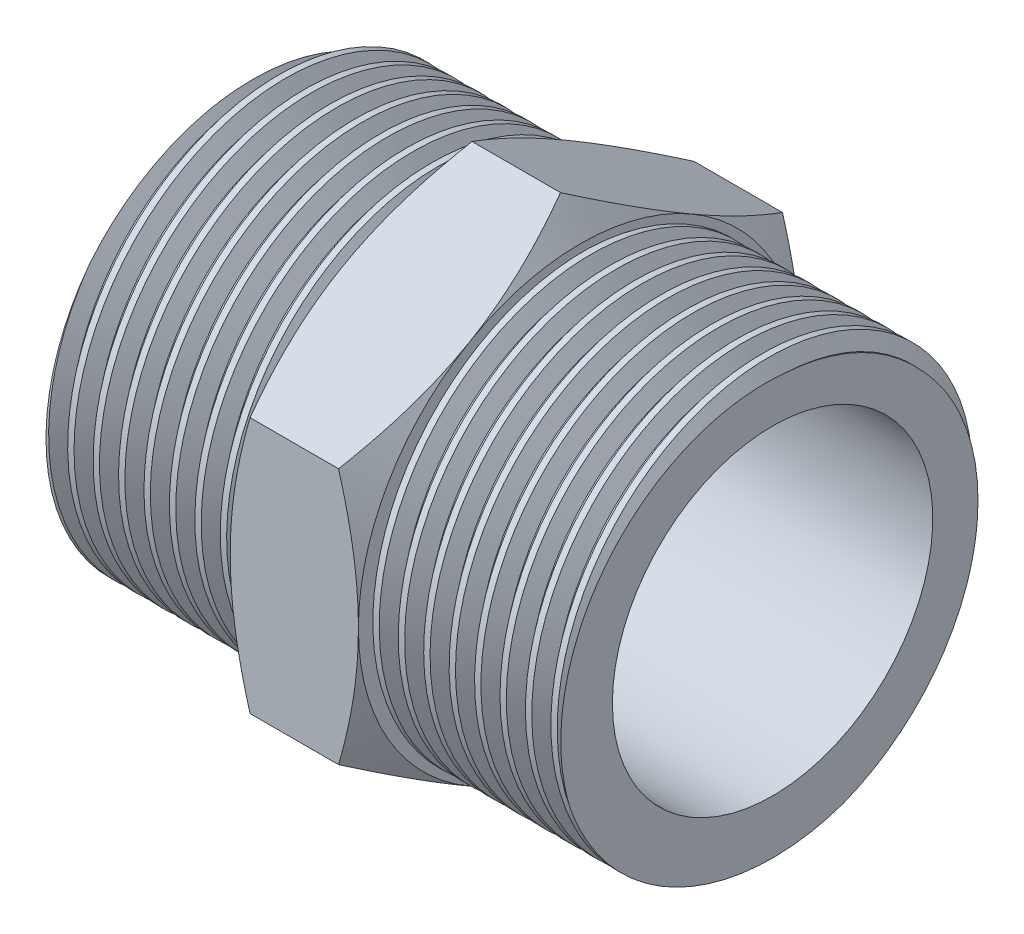
from build123d import *

# Parameters (mm, degrees)
SKETCH2_OUTSIDE_W   = 45.086
SKETCH2_OUTSIDE_H   = 45.086
CUT_EXTRUDE1_DEPTH  = 5
THREAD1_PITCH       = 1.5875
SKETCH7_OUTSIDE_W   = 49.553
SKETCH7_OUTSIDE_H   = 45.164
SKETCH7_OUTSIDE_W_2 = 32
SKETCH7_OUTSIDE_H_2 = 32
CUT_EXTRUDE2_DEPTH  = 20


with BuildPart() as part:
    # Sketch1 → Revolve1 (revolve)
    with BuildSketch(Plane.XY, mode=Mode.PRIVATE) as revolve1_sk:
        Polygon((2.762395693, 16), (-2.762395693, 16), (-4, 13.856406461), (-4, 12.5), (-16, 12.5), (-16, 10), (16, 10), (16, 12.5), (4, 12.5), (4, 13.856406461), align=None)
    revolve(revolve1_sk.sketch.rotate(Axis((0, 0, 0), (1, 0, 0)), 90), axis=Axis((0, 0, 0), (1, 0, 0)))

    # Sketch2 outside → Cut-Extrude1 (cut, symmetric)
    with BuildSketch(Plane(origin=(0, 0, 0), x_dir=(0, 0, -1), z_dir=(1, 0, 0))):
        Rectangle(SKETCH2_OUTSIDE_W, SKETCH2_OUTSIDE_H)
        Polygon((0, 16), (-13.856406461, 8), (-13.856406461, -8), (0, -16), (13.856406461, -8), (13.856406461, 8), align=None, mode=Mode.SUBTRACT)
    extrude(amount=CUT_EXTRUDE1_DEPTH, both=True, mode=Mode.SUBTRACT)

    # Thread1: arcs per turn and ends read off the stored shape
    # Thread1: the profile of Thread Profile1 profile screwed along a right-hand helix through 22.047244 turns, 8 arcs to a turn; built about Z, then put on its axis
    thread1_z = Axis((0, 0, 0), (0, 0, 1))
    thread1_corners = [(12.4997, 0, -0.000173205), (12.4997, 0, 1.389235701), (13.359259577, 0, 0.892968748), (13.359259577, 0, 0.496093748)]
    with BuildLine(mode=Mode.PRIVATE) as thread1_profile:
        Line(thread1_corners[0], thread1_corners[1])
        Line(thread1_corners[1], thread1_corners[2])
        Line(thread1_corners[2], thread1_corners[3])
        Line(thread1_corners[3], thread1_corners[0])
    thread1_cap = Face(thread1_profile.wire())
    thread1_turn_angles = [0, 22.5, 45, 67.5, 90, 112.5, 135, 157.5, 180, 202.5, 225, 247.5, 270, 292.5, 315, 337.5, 360]
    thread1_turn_weights = [1, 0.9238795325112867, 1, 0.9238795325112867, 1, 0.9238795325112867, 1, 0.9238795325112867, 1, 0.9238795325112867, 1, 0.9238795325112867, 1, 0.9238795325112867, 1, 0.9238795325112867, 1]
    thread1_turn_rails = [Edge.make_bspline([Vector(p[0], p[1], 0).rotate(thread1_z, thread1_turn_angles[k]) / thread1_turn_weights[k] + Vector(0, 0, p[2] + THREAD1_PITCH * thread1_turn_angles[k] / 360) for k in range(17)], [0, 0, 0, 1, 1, 2, 2, 3, 3, 4, 4, 5, 5, 6, 6, 7, 7, 8, 8, 8], 2, thread1_turn_weights) for p in thread1_corners]
    thread1_turn_sides = [Face.make_surface_from_curves(thread1_turn_rails[p[0]], thread1_turn_rails[p[1]]) for p in [(0, 1), (1, 2), (2, 3), (3, 0)]]
    thread1_last_angles = [7920, 7928.504, 7937.008]
    thread1_last_weights = [1, 0.9890055419081952, 1]
    thread1_last_rails = [Edge.make_bspline([Vector(p[0], p[1], 0).rotate(thread1_z, thread1_last_angles[k]) / thread1_last_weights[k] + Vector(0, 0, p[2] + THREAD1_PITCH * thread1_last_angles[k] / 360) for k in range(3)], [0, 0, 0, 1, 1, 1], 2, thread1_last_weights) for p in thread1_corners]
    thread1_last_sides = [Face.make_surface_from_curves(thread1_last_rails[p[0]], thread1_last_rails[p[1]]) for p in [(0, 1), (1, 2), (2, 3), (3, 0)]]
    thread1 = Plane(origin=(18, 0, 0), x_dir=(0, 0, 1), z_dir=(-1, 0, 0)) * Solid(Shell([*[p.moved(Location((0, 0, THREAD1_PITCH * i))) for i in range(22) for p in thread1_turn_sides], *thread1_last_sides, thread1_cap, thread1_cap.rotate(thread1_z, 7937.008).moved(Location((0, 0, THREAD1_PITCH * 7937.008 / 360)))]))
    add(thread1)

    # Sketch7 outside → Cut-Extrude2 (cut, symmetric)
    with BuildSketch(Plane.XY):
        with Locations((-0.1945, 0)):
            Rectangle(SKETCH7_OUTSIDE_W, SKETCH7_OUTSIDE_H)
        Rectangle(SKETCH7_OUTSIDE_W_2, SKETCH7_OUTSIDE_H_2, mode=Mode.SUBTRACT)
    extrude(amount=CUT_EXTRUDE2_DEPTH, both=True, mode=Mode.SUBTRACT)


solid = part.part
